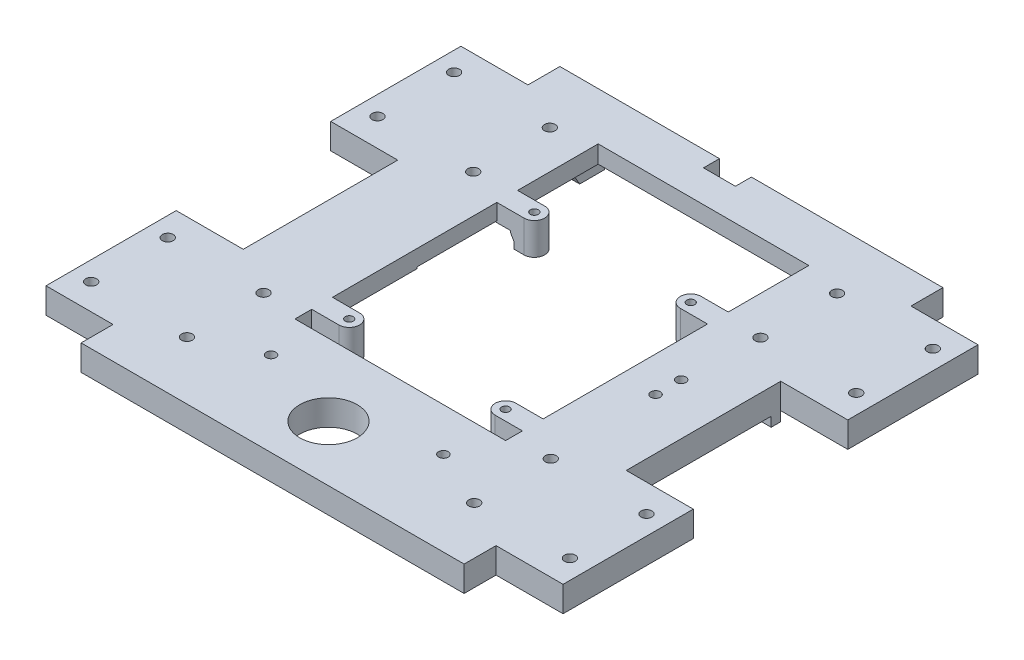
from build123d import *
from OCP.BRepFilletAPI import BRepFilletAPI_MakeChamfer

# Parameters (mm, degrees)
SKETCH_1_W          = 120
SKETCH_1_H          = 150
EXTRUDE_1_DEPTH     = 8
SKETCH_3_W          = 120
SKETCH_3_H          = 3
EXTRUDE_2_DEPTH     = 3
SKETCH_5_W          = 66
SKETCH_5_H          = 95
CUT_EXTRUDE_1_DEPTH = 97.674712309
SKETCH_6_W          = 3
SKETCH_6_H          = 40.8
EXTRUDE_3_DEPTH     = 3
SKETCH_7_W          = 21
SKETCH_7_H          = 40.8
EXTRUDE_4_DEPTH     = 8
SKETCH_8_R          = 1.7
CUT_EXTRUDE_2_DEPTH = 8
SKETCH_9_R          = 1.25
EXTRUDE_5_DEPTH     = 8
SKETCH_10_W         = 66
SKETCH_10_H         = 20
EXTRUDE_6_DEPTH     = 2
CUT_EXTRUDE_3_DEPTH = 3
CUT_EXTRUDE_4_REACH = 112.756
SKETCH_12_W         = 66
SKETCH_12_H         = 20
SKETCH_13_W         = 72
SKETCH_13_H         = 100
SKETCH_13_W_2       = 57.5
SKETCH_13_H_2       = 95
CUT_EXTRUDE_5_DEPTH = 2.5
CHAMFER_1_SIZE      = 2
CHAMFER_1_SIZE2     = 1.154700538
CHAMFER_2_SIZE      = 5.196152423
CHAMFER_2_SIZE_2    = 3
SKETCH_14_W         = 14
SKETCH_14_H         = 25
CUT_EXTRUDE_6_DEPTH = 3
SKETCH_15_R         = 1.25
EXTRUDE_8_DEPTH     = 2
CUT_EXTRUDE_7_REACH = 112.68
SKETCH_16_R         = 9
SKETCH_16_W         = 10
SKETCH_16_H         = 5
CUT_EXTRUDE_8_REACH = 112.68
SKETCH_17_R         = 1.5
CUT_EXTRUDE_9_REACH = 112.68
SKETCH_18_R         = 1.5


with BuildPart() as part:
    # 草图1 → 凸台-拉伸1 (new body)
    with BuildSketch(Plane(origin=(0, 0, 0), x_dir=(1, 0, 0), z_dir=(0, 1, 0))):
        Rectangle(SKETCH_1_W, SKETCH_1_H)
    extrude(amount=EXTRUDE_1_DEPTH)

    # 草图3 → 凸台-拉伸2 (add)
    with BuildSketch(Plane.XZ):
        with Locations((0, 22.7)):
            Rectangle(SKETCH_3_W, SKETCH_3_H)
        with Locations((0, -22.7)):
            Rectangle(SKETCH_3_W, SKETCH_3_H)
    extrude(amount=EXTRUDE_2_DEPTH)

    # 草图5 → 切除-拉伸1 (cut, through all)
    with BuildSketch(Plane(origin=(0, 8, 0), x_dir=(1, 0, 0), z_dir=(0, 1, 0))):
        with Locations((0, 12.5)):
            Rectangle(SKETCH_5_W, SKETCH_5_H)
    extrude(amount=-CUT_EXTRUDE_1_DEPTH, mode=Mode.SUBTRACT)

    # 草图6 → 凸台-拉伸3 (add)
    with BuildSketch(Plane.XZ):
        with Locations((-37.5, -44.6)):
            Rectangle(SKETCH_6_W, SKETCH_6_H)
        with Locations((37.5, -44.6)):
            Rectangle(SKETCH_6_W, SKETCH_6_H)
        with Locations((37.5, 44.6)):
            Rectangle(SKETCH_6_W, SKETCH_6_H)
        with Locations((-37.5, 44.6)):
            Rectangle(SKETCH_6_W, SKETCH_6_H)
    extrude(amount=EXTRUDE_3_DEPTH)

    # 草图7 → 凸台-拉伸4 (add)
    with BuildSketch(Plane(origin=(0, 8, 0), x_dir=(1, 0, 0), z_dir=(0, 1, 0))):
        with Locations((-70.5, 44.6)):
            Rectangle(SKETCH_7_W, SKETCH_7_H)
        with Locations((70.5, 44.6)):
            Rectangle(SKETCH_7_W, SKETCH_7_H)
        with Locations((70.5, -44.6)):
            Rectangle(SKETCH_7_W, SKETCH_7_H)
        with Locations((-70.5, -44.6)):
            Rectangle(SKETCH_7_W, SKETCH_7_H)
    extrude(amount=-EXTRUDE_4_DEPTH)

    # 草图8 → 切除-拉伸2 (cut)
    with BuildSketch(Plane.XZ):
        with Locations(Location((-75, -32.85, 0), (0, 0, 270))):
            Circle(SKETCH_8_R)
        with Locations(Location((-45, -32.85, 0), (0, 0, 270))):
            Circle(SKETCH_8_R)
        with Locations(Location((-75, -56.85, 0), (0, 0, 270))):
            Circle(SKETCH_8_R)
        with Locations(Location((-45, -56.85, 0), (0, 0, 270))):
            Circle(SKETCH_8_R)
        with Locations(Location((45, -56.85, 0), (0, 0, 90))):
            Circle(SKETCH_8_R)
        with Locations(Location((75, -56.85, 0), (0, 0, 90))):
            Circle(SKETCH_8_R)
        with Locations(Location((45, -32.85, 0), (0, 0, 90))):
            Circle(SKETCH_8_R)
        with Locations(Location((75, -32.85, 0), (0, 0, 90))):
            Circle(SKETCH_8_R)
        with Locations(Location((75, 32.85, 0), (0, 0, 270))):
            Circle(SKETCH_8_R)
        with Locations(Location((45, 32.85, 0), (0, 0, 270))):
            Circle(SKETCH_8_R)
        with Locations(Location((75, 56.85, 0), (0, 0, 270))):
            Circle(SKETCH_8_R)
        with Locations(Location((45, 56.85, 0), (0, 0, 270))):
            Circle(SKETCH_8_R)
        with Locations(Location((-45, 56.85, 0), (0, 0, 90))):
            Circle(SKETCH_8_R)
        with Locations(Location((-75, 56.85, 0), (0, 0, 90))):
            Circle(SKETCH_8_R)
        with Locations(Location((-45, 32.85, 0), (0, 0, 90))):
            Circle(SKETCH_8_R)
        with Locations(Location((-75, 32.85, 0), (0, 0, 90))):
            Circle(SKETCH_8_R)
    extrude(amount=-CUT_EXTRUDE_2_DEPTH, mode=Mode.SUBTRACT)

    # 草图9 → 凸台-拉伸5 (add)
    # profile 1 of 4: a face of its own
    with BuildSketch(Plane(origin=(0, 8, 0), x_dir=(1, 0, 0), z_dir=(0, 1, 0))):
        with BuildLine():
            Line((24.5, 34.75), (33, 34.75))
            Line((33, 34.75), (33, 28.25))
            Line((33, 28.25), (24.5, 28.25))
            ThreePointArc((24.5, 28.25), (21.25, 31.5), (24.5, 34.75))
        make_face()
        with Locations(Location((24.5, 31.5, 0), (0, 0, 270))):
            Circle(SKETCH_9_R, mode=Mode.SUBTRACT)
    # profile 2 of 4: a face of its own
    with BuildSketch(Plane(origin=(0, 8, 0), x_dir=(1, 0, 0), z_dir=(0, 1, 0))):
        with BuildLine():
            Line((24.5, -23.25), (33, -23.25))
            Line((33, -23.25), (33, -29.75))
            Line((33, -29.75), (24.5, -29.75))
            ThreePointArc((24.5, -29.75), (21.25, -26.5), (24.5, -23.25))
        make_face()
        with Locations(Location((24.5, -26.5, 0), (0, 0, 270))):
            Circle(SKETCH_9_R, mode=Mode.SUBTRACT)
    # profile 3 of 4: a face of its own
    with BuildSketch(Plane(origin=(0, 8, 0), x_dir=(1, 0, 0), z_dir=(0, 1, 0))):
        with BuildLine():
            Line((-24.5, -23.25), (-33, -23.25))
            Line((-33, -23.25), (-33, -29.75))
            Line((-33, -29.75), (-24.5, -29.75))
            ThreePointArc((-24.5, -29.75), (-21.25, -26.5), (-24.5, -23.25))
        make_face()
        with Locations(Location((-24.5, -26.5, 0), (0, 0, 90))):
            Circle(SKETCH_9_R, mode=Mode.SUBTRACT)
    # profile 4 of 4: a face of its own
    with BuildSketch(Plane(origin=(0, 8, 0), x_dir=(1, 0, 0), z_dir=(0, 1, 0))):
        with BuildLine():
            Line((-24.5, 34.75), (-33, 34.75))
            Line((-33, 34.75), (-33, 28.25))
            Line((-33, 28.25), (-24.5, 28.25))
            ThreePointArc((-24.5, 28.25), (-21.25, 31.5), (-24.5, 34.75))
        make_face()
        with Locations(Location((-24.5, 31.5, 0), (0, 0, 90))):
            Circle(SKETCH_9_R, mode=Mode.SUBTRACT)
    extrude(amount=-EXTRUDE_5_DEPTH)

    # 草图10 → 凸台-拉伸6 (add)
    with BuildSketch(Plane(origin=(0, 8, 0), x_dir=(1, 0, 0), z_dir=(0, 1, 0))):
        with Locations((0, 50)):
            Rectangle(SKETCH_10_W, SKETCH_10_H)
    extrude(amount=-EXTRUDE_6_DEPTH)

    # 草图11 → 切除-拉伸3 (cut)
    with BuildSketch(Plane.XZ.offset(3)):
        Polygon((-39, -24.2), (-54, -24.2), (-54, -21.2), (-33, -21.2), (-33, -24.2), (-36, -24.2), (-36, -54.2), (-39, -54.2), align=None)
        Polygon((-36, 54.2), (-39, 54.2), (-39, 24.2), (-54, 24.2), (-54, 21.2), (-33, 21.2), (-33, 24.2), (-36, 24.2), align=None)
        Polygon((36, 24.2), (36, 54.2), (39, 54.2), (39, 24.2), (54, 24.2), (54, 21.2), (33, 21.2), (33, 24.2), align=None)
        Polygon((36, -54.2), (39, -54.2), (39, -24.2), (54, -24.2), (54, -21.2), (33, -21.2), (33, -24.2), (36, -24.2), align=None)
    extrude(amount=-CUT_EXTRUDE_3_DEPTH, mode=Mode.SUBTRACT)

    # 草图12 → 切除-拉伸4 (cut, up to next)
    with BuildSketch(Plane.XZ.offset(-6), mode=Mode.PRIVATE) as cut_extrude_4_sk1:
        with Locations((0, -50)):
            Rectangle(SKETCH_12_W, SKETCH_12_H)
    cut_extrude_4_tool1 = extrude(cut_extrude_4_sk1.sketch, amount=-CUT_EXTRUDE_4_REACH, mode=Mode.PRIVATE) & part.part
    add(cut_extrude_4_tool1.solids().sort_by_distance((0, 6, -50))[0], mode=Mode.SUBTRACT)

    # 草图13 → 切除-拉伸5 (cut)
    with BuildSketch(Plane.XZ):
        with Locations((0, -12.5)):
            Rectangle(SKETCH_13_W, SKETCH_13_H)
        with Locations((0, -12.5)):
            Rectangle(SKETCH_13_W_2, SKETCH_13_H_2, mode=Mode.SUBTRACT)
    extrude(amount=-CUT_EXTRUDE_5_DEPTH, mode=Mode.SUBTRACT)

    # 倒角1: one chamfer whose edges measure the first distance from different faces: ONE call of the kernel's chamfer builder (chamfer() names one face for all edges)
    chamfer_1_edges_1 = [part.edges().sort_by_distance(p)[0] for p in [
        (28.75, 0, -31.5),
    ]]
    chamfer_1_side_1 = [part.faces().sort_by_distance(p)[0] for p in [
        (28.75, 1.25, -31.5),
    ]]
    chamfer_1_edges_2 = [part.edges().sort_by_distance(p)[0] for p in [
        (-28.75, 0, 26.5),
    ]]
    chamfer_1_side_2 = [part.faces().sort_by_distance(p)[0] for p in [
        (-28.75, 1.25, 26.5),
    ]]
    chamfer_1_edges_3 = [part.edges().sort_by_distance(p)[0] for p in [
        (28.75, 0, 26.5),
    ]]
    chamfer_1_side_3 = [part.faces().sort_by_distance(p)[0] for p in [
        (28.75, 1.25, 26.5),
    ]]
    chamfer_1_edges_4 = [part.edges().sort_by_distance(p)[0] for p in [
        (-28.75, 0, -31.5),
    ]]
    chamfer_1_side_4 = [part.faces().sort_by_distance(p)[0] for p in [
        (-28.75, 1.25, -31.5),
    ]]
    chamfer_1 = BRepFilletAPI_MakeChamfer(part.part.solid().wrapped)
    for e in chamfer_1_edges_1:
        chamfer_1.Add(CHAMFER_1_SIZE, CHAMFER_1_SIZE2, e.wrapped, chamfer_1_side_1[0].wrapped)  # the first distance lies on this face
    for e in chamfer_1_edges_2:
        chamfer_1.Add(CHAMFER_1_SIZE, CHAMFER_1_SIZE2, e.wrapped, chamfer_1_side_2[0].wrapped)  # the first distance lies on this face
    for e in chamfer_1_edges_3:
        chamfer_1.Add(CHAMFER_1_SIZE, CHAMFER_1_SIZE2, e.wrapped, chamfer_1_side_3[0].wrapped)  # the first distance lies on this face
    for e in chamfer_1_edges_4:
        chamfer_1.Add(CHAMFER_1_SIZE, CHAMFER_1_SIZE2, e.wrapped, chamfer_1_side_4[0].wrapped)  # the first distance lies on this face
    add(Compound.cast(chamfer_1.Shape()), mode=Mode.REPLACE)

    # 倒角2
    # the kernel refuses this chamfer: 5.196152423, 3 mm, written as the material it takes off along each edge
    with BuildSketch(Plane(origin=(22.557108088, -3, 54.2), x_dir=(0, 0.9998132206222079, -0.01932676561270102), z_dir=(1, 0, 0))) as chamfer_2_piece_1_section:
        Polygon((CHAMFER_2_SIZE * 0.999813220566, CHAMFER_2_SIZE * 0.0193267656116), (-CHAMFER_2_SIZE_2 * 0.0193267656127, CHAMFER_2_SIZE_2 * 0.999813220622), (0, 0), align=None)
    chamfer_2_piece_1 = extrude(amount=29.885783824, mode=Mode.PRIVATE)
    chamfer_2_piece_1 = split(chamfer_2_piece_1, bisect_by=Plane(origin=(37.5, 0, 55.319508443), z_dir=(0, -1, 0)), keep=Keep.TOP, mode=Mode.PRIVATE)
    add(chamfer_2_piece_1, mode=Mode.SUBTRACT)
    with BuildSketch(Plane(origin=(54, -3, 37.642891912), x_dir=(0.9983227437537926, -0.057893862402671296, 0), z_dir=(0, 0, -1))) as chamfer_2_piece_2_section:
        Polygon((CHAMFER_2_SIZE_2 * 0.998322743754, -CHAMFER_2_SIZE_2 * 0.0578938624027), (-CHAMFER_2_SIZE * 0.0578938623994, -CHAMFER_2_SIZE * 0.998322743697), (0, 0), align=None)
    chamfer_2_piece_2 = extrude(amount=29.885783824, mode=Mode.PRIVATE)
    chamfer_2_piece_2 = split(chamfer_2_piece_2, bisect_by=Plane(origin=(55.119508443, 0, 22.7), z_dir=(0, -1, 0)), keep=Keep.TOP, mode=Mode.PRIVATE)
    add(chamfer_2_piece_2, mode=Mode.SUBTRACT)
    with BuildSketch(Plane(origin=(54, -3, -37.642891912), x_dir=(0.9983227437537926, -0.057893862402671296, 0), z_dir=(0, 0, 1))) as chamfer_2_piece_3_section:
        Polygon((CHAMFER_2_SIZE_2 * 0.998322743754, CHAMFER_2_SIZE_2 * 0.0578938624027), (-CHAMFER_2_SIZE * 0.0578938623994, CHAMFER_2_SIZE * 0.998322743697), (0, 0), align=None)
    chamfer_2_piece_3 = extrude(amount=29.885783824, mode=Mode.PRIVATE)
    chamfer_2_piece_3 = split(chamfer_2_piece_3, bisect_by=Plane(origin=(55.119508443, 0, -22.7), z_dir=(0, -1, 0)), keep=Keep.TOP, mode=Mode.PRIVATE)
    add(chamfer_2_piece_3, mode=Mode.SUBTRACT)
    with BuildSketch(Plane(origin=(22.557108088, -3, -54.2), x_dir=(0, 0.9998132206222079, 0.01932676561270102), z_dir=(1, 0, 0))) as chamfer_2_piece_4_section:
        Polygon((CHAMFER_2_SIZE * 0.999813220566, -CHAMFER_2_SIZE * 0.0193267656116), (-CHAMFER_2_SIZE_2 * 0.0193267656127, -CHAMFER_2_SIZE_2 * 0.999813220622), (0, 0), align=None)
    chamfer_2_piece_4 = extrude(amount=29.885783824, mode=Mode.PRIVATE)
    chamfer_2_piece_4 = split(chamfer_2_piece_4, bisect_by=Plane(origin=(37.5, 0, -55.319508443), z_dir=(0, -1, 0)), keep=Keep.TOP, mode=Mode.PRIVATE)
    add(chamfer_2_piece_4, mode=Mode.SUBTRACT)
    with BuildSketch(Plane(origin=(-22.557108088, -3, -54.2), x_dir=(0, -0.057893862402671296, -0.9983227437537926), z_dir=(-1, 0, 0))) as chamfer_2_piece_5_section:
        Polygon((CHAMFER_2_SIZE_2 * 0.998322743754, -CHAMFER_2_SIZE_2 * 0.0578938624027), (-CHAMFER_2_SIZE * 0.0578938623994, -CHAMFER_2_SIZE * 0.998322743697), (0, 0), align=None)
    chamfer_2_piece_5 = extrude(amount=29.885783824, mode=Mode.PRIVATE)
    chamfer_2_piece_5 = split(chamfer_2_piece_5, bisect_by=Plane(origin=(-37.5, 0, -55.319508443), z_dir=(0, -1, 0)), keep=Keep.TOP, mode=Mode.PRIVATE)
    add(chamfer_2_piece_5, mode=Mode.SUBTRACT)
    with BuildSketch(Plane(origin=(-54, -3, -37.642891912), x_dir=(-0.9983227437537926, -0.057893862402671296, 0), z_dir=(0, 0, 1))) as chamfer_2_piece_6_section:
        Polygon((CHAMFER_2_SIZE_2 * 0.998322743754, -CHAMFER_2_SIZE_2 * 0.0578938624027), (-CHAMFER_2_SIZE * 0.0578938623994, -CHAMFER_2_SIZE * 0.998322743697), (0, 0), align=None)
    chamfer_2_piece_6 = extrude(amount=29.885783824, mode=Mode.PRIVATE)
    chamfer_2_piece_6 = split(chamfer_2_piece_6, bisect_by=Plane(origin=(-55.119508443, 0, -22.7), z_dir=(0, -1, 0)), keep=Keep.TOP, mode=Mode.PRIVATE)
    add(chamfer_2_piece_6, mode=Mode.SUBTRACT)
    with BuildSketch(Plane(origin=(-54, -3, 37.642891912), x_dir=(-0.9983227437537926, -0.057893862402671296, 0), z_dir=(0, 0, -1))) as chamfer_2_piece_7_section:
        Polygon((CHAMFER_2_SIZE_2 * 0.998322743754, CHAMFER_2_SIZE_2 * 0.0578938624027), (-CHAMFER_2_SIZE * 0.0578938623994, CHAMFER_2_SIZE * 0.998322743697), (0, 0), align=None)
    chamfer_2_piece_7 = extrude(amount=29.885783824, mode=Mode.PRIVATE)
    chamfer_2_piece_7 = split(chamfer_2_piece_7, bisect_by=Plane(origin=(-55.119508443, 0, 22.7), z_dir=(0, -1, 0)), keep=Keep.TOP, mode=Mode.PRIVATE)
    add(chamfer_2_piece_7, mode=Mode.SUBTRACT)
    with BuildSketch(Plane(origin=(-22.557108088, -3, 54.2), x_dir=(0, 0.9998132206222079, -0.01932676561270102), z_dir=(-1, 0, 0))) as chamfer_2_piece_8_section:
        Polygon((CHAMFER_2_SIZE * 0.999813220566, -CHAMFER_2_SIZE * 0.0193267656116), (-CHAMFER_2_SIZE_2 * 0.0193267656127, -CHAMFER_2_SIZE_2 * 0.999813220622), (0, 0), align=None)
    chamfer_2_piece_8 = extrude(amount=29.885783824, mode=Mode.PRIVATE)
    chamfer_2_piece_8 = split(chamfer_2_piece_8, bisect_by=Plane(origin=(-37.5, 0, 55.319508443), z_dir=(0, -1, 0)), keep=Keep.TOP, mode=Mode.PRIVATE)
    add(chamfer_2_piece_8, mode=Mode.SUBTRACT)

    # 草图14 → 切除-拉伸6 (cut)
    with BuildSketch(Plane.XZ):
        with Locations((-40, -15.75)):
            Rectangle(SKETCH_14_W, SKETCH_14_H)
    extrude(amount=-CUT_EXTRUDE_6_DEPTH, mode=Mode.SUBTRACT)

    # 草图15 → 凸台-拉伸8 (add)
    # profile 1 of 4: a face of its own
    with BuildSketch(Plane.XZ):
        with BuildLine():
            Line((-24.5, -28.25), (-27.595299462, -28.25))
            Line((-27.595299462, -28.25), (-27.595299462, -34.75))
            Line((-27.595299462, -34.75), (-24.5, -34.75))
            ThreePointArc((-24.5, -34.75), (-21.25, -31.5), (-24.5, -28.25))
        make_face()
        with Locations(Location((-24.5, -31.5, 0), (0, 0, 270))):
            Circle(SKETCH_15_R, mode=Mode.SUBTRACT)
    # profile 2 of 4: a face of its own
    with BuildSketch(Plane.XZ):
        with BuildLine():
            Line((-24.5, 29.75), (-27.595299462, 29.75))
            Line((-27.595299462, 29.75), (-27.595299462, 23.25))
            Line((-27.595299462, 23.25), (-24.5, 23.25))
            ThreePointArc((-24.5, 23.25), (-21.25, 26.5), (-24.5, 29.75))
        make_face()
        with Locations(Location((-24.5, 26.5, 0), (0, 0, 270))):
            Circle(SKETCH_15_R, mode=Mode.SUBTRACT)
    # profile 3 of 4: a face of its own
    with BuildSketch(Plane.XZ):
        with BuildLine():
            Line((24.5, 23.25), (27.595299462, 23.25))
            Line((27.595299462, 23.25), (27.595299462, 29.75))
            Line((27.595299462, 29.75), (24.5, 29.75))
            ThreePointArc((24.5, 29.75), (21.25, 26.5), (24.5, 23.25))
        make_face()
        with Locations(Location((24.5, 26.5, 0), (0, 0, 90))):
            Circle(SKETCH_15_R, mode=Mode.SUBTRACT)
    # profile 4 of 4: a face of its own
    with BuildSketch(Plane.XZ):
        with BuildLine():
            Line((24.5, -34.75), (27.595299462, -34.75))
            Line((27.595299462, -34.75), (27.595299462, -28.25))
            Line((27.595299462, -28.25), (24.5, -28.25))
            ThreePointArc((24.5, -28.25), (21.25, -31.5), (24.5, -34.75))
        make_face()
        with Locations(Location((24.5, -31.5, 0), (0, 0, 90))):
            Circle(SKETCH_15_R, mode=Mode.SUBTRACT)
    extrude(amount=EXTRUDE_8_DEPTH)

    # 草图16 → 切除-拉伸7 (cut, up to next)
    with BuildSketch(Plane.XZ, mode=Mode.PRIVATE) as cut_extrude_7_sk1:
        with Locations(Location((0, 57.5, 0), (0, 0, 270))):
            Circle(SKETCH_16_R)
    cut_extrude_7_tool1 = extrude(cut_extrude_7_sk1.sketch, amount=-CUT_EXTRUDE_7_REACH, mode=Mode.PRIVATE) & part.part
    # 草图16 → 切除-拉伸7 (cut, up to next)
    with BuildSketch(Plane.XZ, mode=Mode.PRIVATE) as cut_extrude_7_sk2:
        with Locations((-5, -72.5)):
            Rectangle(SKETCH_16_W, SKETCH_16_H)
    cut_extrude_7_tool2 = extrude(cut_extrude_7_sk2.sketch, amount=-CUT_EXTRUDE_7_REACH, mode=Mode.PRIVATE) & part.part
    add(cut_extrude_7_tool1.solids().sort_by_distance((0, 0, 57.5))[0], mode=Mode.SUBTRACT)
    add(cut_extrude_7_tool2.solids().sort_by_distance((-5, 0, -72.5))[0], mode=Mode.SUBTRACT)

    # 草图17 → 切除-拉伸8 (cut, up to next)
    with BuildSketch(Plane.XZ, mode=Mode.PRIVATE) as cut_extrude_8_sk1:
        with Locations(Location((-27, 48.5, 0), (0, 0, 270))):
            Circle(SKETCH_17_R)
    cut_extrude_8_tool1 = extrude(cut_extrude_8_sk1.sketch, amount=-CUT_EXTRUDE_8_REACH, mode=Mode.PRIVATE) & part.part
    # 草图17 → 切除-拉伸8 (cut, up to next)
    with BuildSketch(Plane.XZ, mode=Mode.PRIVATE) as cut_extrude_8_sk2:
        with Locations(Location((27, 48.5, 0), (0, 0, 270))):
            Circle(SKETCH_17_R)
    cut_extrude_8_tool2 = extrude(cut_extrude_8_sk2.sketch, amount=-CUT_EXTRUDE_8_REACH, mode=Mode.PRIVATE) & part.part
    add(cut_extrude_8_tool1.solids().sort_by_distance((-27, 0, 48.5))[0], mode=Mode.SUBTRACT)
    add(cut_extrude_8_tool2.solids().sort_by_distance((27, 0, 48.5))[0], mode=Mode.SUBTRACT)

    # 草图18 → 切除-拉伸9 (cut, up to next)
    with BuildSketch(Plane.XZ, mode=Mode.PRIVATE) as cut_extrude_9_sk1:
        with Locations(Location((44, -0.983974596, 0), (0, 0, 270))):
            Circle(SKETCH_18_R)
    cut_extrude_9_tool1 = extrude(cut_extrude_9_sk1.sketch, amount=-CUT_EXTRUDE_9_REACH, mode=Mode.PRIVATE) & part.part
    # 草图18 → 切除-拉伸9 (cut, up to next)
    with BuildSketch(Plane.XZ, mode=Mode.PRIVATE) as cut_extrude_9_sk2:
        with Locations(Location((44, -8.983974596, 0), (0, 0, 270))):
            Circle(SKETCH_18_R)
    cut_extrude_9_tool2 = extrude(cut_extrude_9_sk2.sketch, amount=-CUT_EXTRUDE_9_REACH, mode=Mode.PRIVATE) & part.part
    add(cut_extrude_9_tool1.solids().sort_by_distance((44, 0, -0.983975))[0], mode=Mode.SUBTRACT)
    add(cut_extrude_9_tool2.solids().sort_by_distance((44, 0, -8.983975))[0], mode=Mode.SUBTRACT)


solid = part.part
